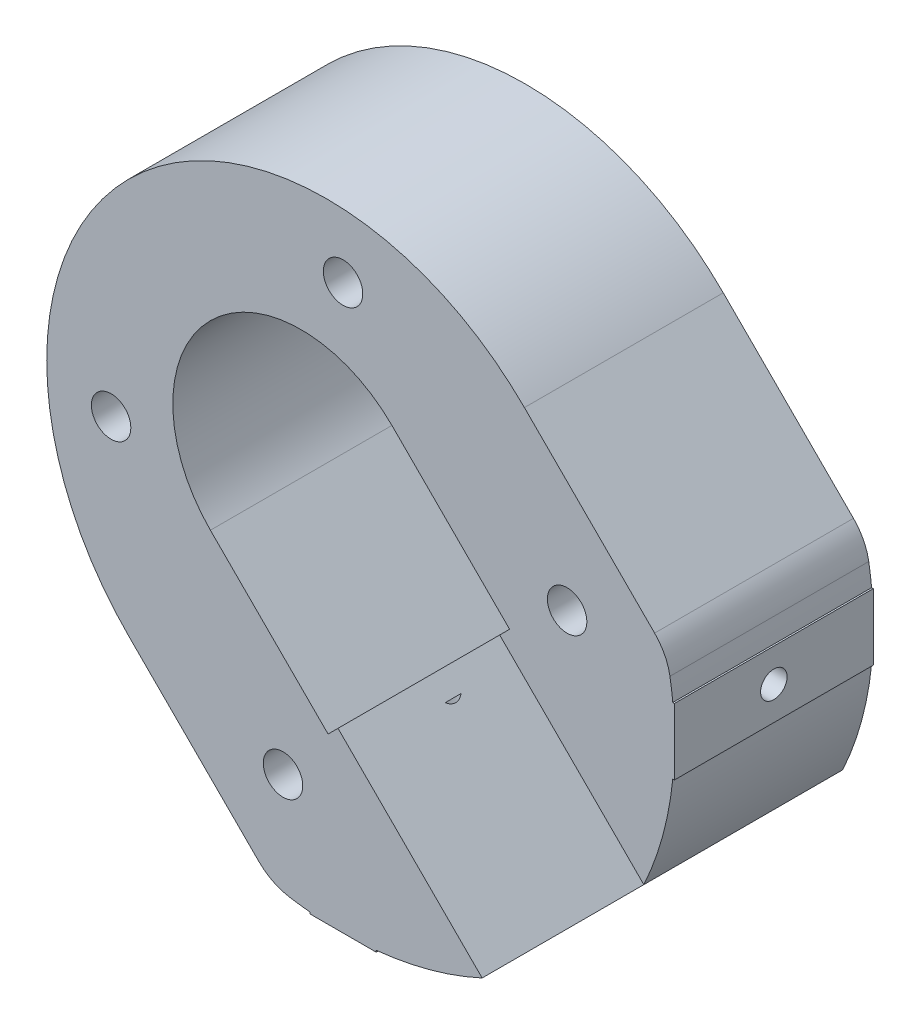
from build123d import *

# Parameters (mm, degrees)
BOSS_EXTRUDE1_DEPTH      = 15
BOSS_EXTRUDE1_DEPTH_BACK = 15
SKETCH2_R                = 2
CUT_EXTRUDE1_DEPTH       = 24
SKETCH3_R                = 2
CUT_EXTRUDE2_DEPTH       = 24
SKETCH6_R                = 2.9765625
CUT_EXTRUDE4_DEPTH       = 73.284161474


with BuildPart() as part:
    # Sketch1 → Boss-Extrude1 (new, two sides: drawn at the far end of the back side and taken through both)
    with BuildSketch(Plane.XY.offset(-BOSS_EXTRUDE1_DEPTH_BACK)):
        with BuildLine():
            Line((5, -50), (-5, -50))
            Line((-5, -50), (-5, -49.749371855))
            ThreePointArc((-5, -49.749371855), (-6.608385874, -49.561368384), (-8.209840211, -49.321379986))
            ThreePointArc((-8.209840211, -49.321379986), (-10.634728593, -48.517643399), (-12.698502349, -47.012015938))
            Line((-12.698502349, -47.012015938), (-32.34439039, -27.366127897))
            ThreePointArc((-32.34439039, -27.366127897), (-32.34439039, 32.34439039), (27.366127897, 32.34439039))
            Line((27.366127897, 32.34439039), (47.012015938, 12.698502349))
            ThreePointArc((47.012015938, 12.698502349), (48.517643399, 10.634728593), (49.321379986, 8.209840211))
            ThreePointArc((49.321379986, 8.209840211), (49.561368384, 6.608385874), (49.749371855, 5))
            Line((49.749371855, 5), (50, 5))
            Line((50, 5), (50, -5))
            Line((50, -5), (49.749371855, -5))
            ThreePointArc((49.749371855, -5), (48.232775306, -13.175711984), (45.38220814, -20.987024189))
            Line((45.38220814, -20.987024189), (23.63175062, 0.763433331))
            Line((23.63175062, 0.763433331), (25.128673235, 2.260355947))
            Line((25.128673235, 2.260355947), (7.371511647, 20.017517534))
            ThreePointArc((7.371511647, 20.017517534), (-20.017517534, 20.017517534), (-20.017517534, -7.371511647))
            Line((-20.017517534, -7.371511647), (-2.260355947, -25.128673235))
            Line((-2.260355947, -25.128673235), (-0.763433331, -23.63175062))
            Line((-0.763433331, -23.63175062), (20.987024189, -45.38220814))
            ThreePointArc((20.987024189, -45.38220814), (13.175711984, -48.232775306), (5, -49.749371855))
            Line((5, -49.749371855), (5, -50))
        make_face()
    extrude(amount=BOSS_EXTRUDE1_DEPTH + BOSS_EXTRUDE1_DEPTH_BACK)

    # Sketch2 → Cut-Extrude1 (cut)
    with BuildSketch(Plane(origin=(0, -50, 0), x_dir=(1, 0, 0), z_dir=(0, 1, 0))):
        Circle(SKETCH2_R)
    extrude(amount=CUT_EXTRUDE1_DEPTH, mode=Mode.SUBTRACT)

    # Sketch3 → Cut-Extrude2 (cut)
    with BuildSketch(Plane(origin=(50, 0, 0), x_dir=(0, 0, -1), z_dir=(1, 0, 0))):
        Circle(SKETCH3_R)
    extrude(amount=-CUT_EXTRUDE2_DEPTH, mode=Mode.SUBTRACT)

    # Sketch6 → Cut-Extrude4 (cut, through all)
    with BuildSketch(Plane.XY):
        with Locations((-9.058666579, -33.80740392)):
            Circle(SKETCH6_R)
        with Locations((-35, 0)):
            Circle(SKETCH6_R)
        with Locations((0, 35)):
            Circle(SKETCH6_R)
        with Locations((33.80740392, 9.058666579)):
            Circle(SKETCH6_R)
    extrude(amount=CUT_EXTRUDE4_DEPTH, mode=Mode.SUBTRACT)


solid = part.part
